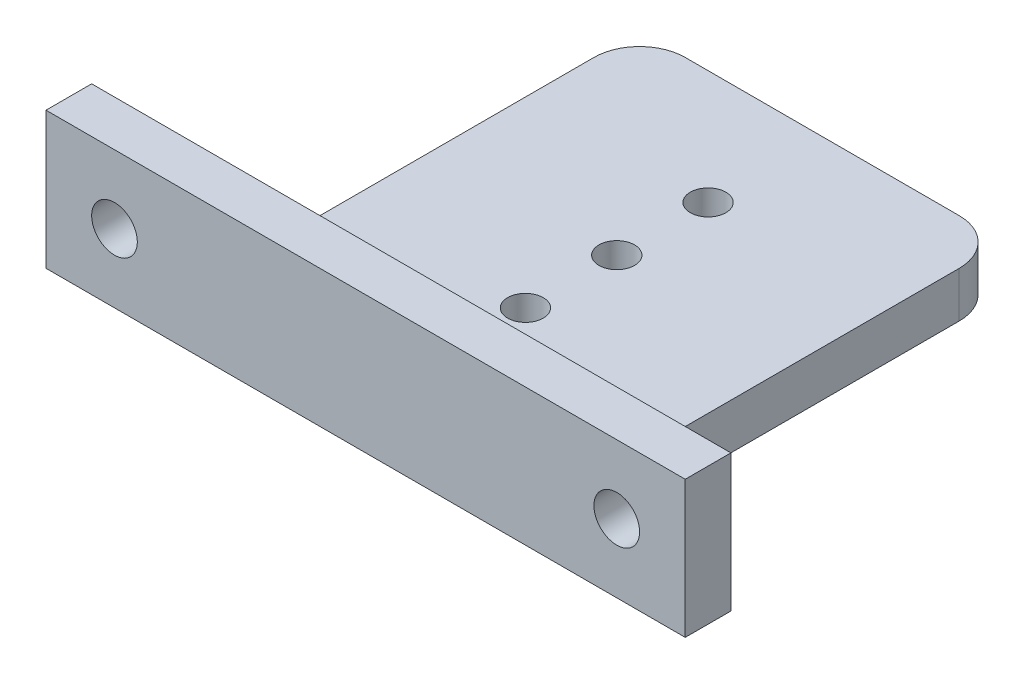
from build123d import *

# Parameters (mm, degrees)
BOSS_EXTRUDE1_DEPTH = 5
SKETCH2_W           = 70
SKETCH2_H           = 5
BOSS_EXTRUDE2_DEPTH = 10
SKETCH3_R           = 1.95
CUT_EXTRUDE1_DEPTH  = 45.158804332
FILLET1_R           = 10
SKETCH4_R           = 2.5
CUT_EXTRUDE2_DEPTH  = 63.84902545
SKETCH5_R           = 5
CUT_EXTRUDE3_DEPTH  = 17
FILLET2_R           = 5


with BuildPart() as part:
    # Sketch1 → Boss-Extrude1 (new body)
    with BuildSketch(Plane(origin=(0, 0, 0), x_dir=(1, 0, 0), z_dir=(0, 1, 0))):
        Polygon((-35, -25), (-20, -25), (20, -25), (35, -25), (35, -20), (20, -20), (20, 25), (-20, 25), (-20, -20), (-35, -20), align=None)
    extrude(amount=BOSS_EXTRUDE1_DEPTH)

    # Sketch2 → Boss-Extrude2 (add)
    with BuildSketch(Plane(origin=(0, 5, 0), x_dir=(1, 0, 0), z_dir=(0, 1, 0))):
        with Locations((0, -22.5)):
            Rectangle(SKETCH2_W, SKETCH2_H)
    extrude(amount=BOSS_EXTRUDE2_DEPTH)

    # Sketch3 → Cut-Extrude1 (cut, through all)
    with BuildSketch(Plane(origin=(0, 5, 0), x_dir=(1, 0, 0), z_dir=(0, 1, 0))):
        with Locations(Location((0, 12.5, 0), (0, 0, 270))):
            Circle(SKETCH3_R)
        with Locations(Location((0, -7.5, 0), (0, 0, 90))):
            Circle(SKETCH3_R)
        with Locations(Location((0, 2.5, 0), (0, 0, 270))):
            Circle(SKETCH3_R)
    extrude(amount=-CUT_EXTRUDE1_DEPTH, mode=Mode.SUBTRACT)

    # Fillet1
    fillet1_edges = [part.edges().sort_by_distance(p)[0] for p in [
        (-20, 2.5, 20),
        (20, 2.5, 20),
        (0, 5, 20),
    ]]
    fillet(fillet1_edges, radius=FILLET1_R - 0.0001)  # a hair under: the kernel refuses the full size

    # Sketch4 → Cut-Extrude2 (cut, through all)
    with BuildSketch(Plane.XY.offset(25)):
        with Locations((-27.5, 7.5)):
            Circle(SKETCH4_R)
        with Locations((27.5, 7.5)):
            Circle(SKETCH4_R)
    extrude(amount=-CUT_EXTRUDE2_DEPTH, mode=Mode.SUBTRACT)

    # Sketch5 → Cut-Extrude3 (cut)
    with BuildSketch(Plane(origin=(0, 0, 20), x_dir=(-1, 0, 0), z_dir=(0, 0, -1))):
        with Locations((27.5, 7.5)):
            Circle(SKETCH5_R)
        with Locations((-27.5, 7.5)):
            Circle(SKETCH5_R)
    extrude(amount=CUT_EXTRUDE3_DEPTH, mode=Mode.SUBTRACT)

    # Fillet2
    fillet2_edges = [part.edges().sort_by_distance(p)[0] for p in [
        (-20, 2.5, -25),
        (20, 2.5, -25),
    ]]
    fillet(fillet2_edges, radius=FILLET2_R)


solid = part.part
